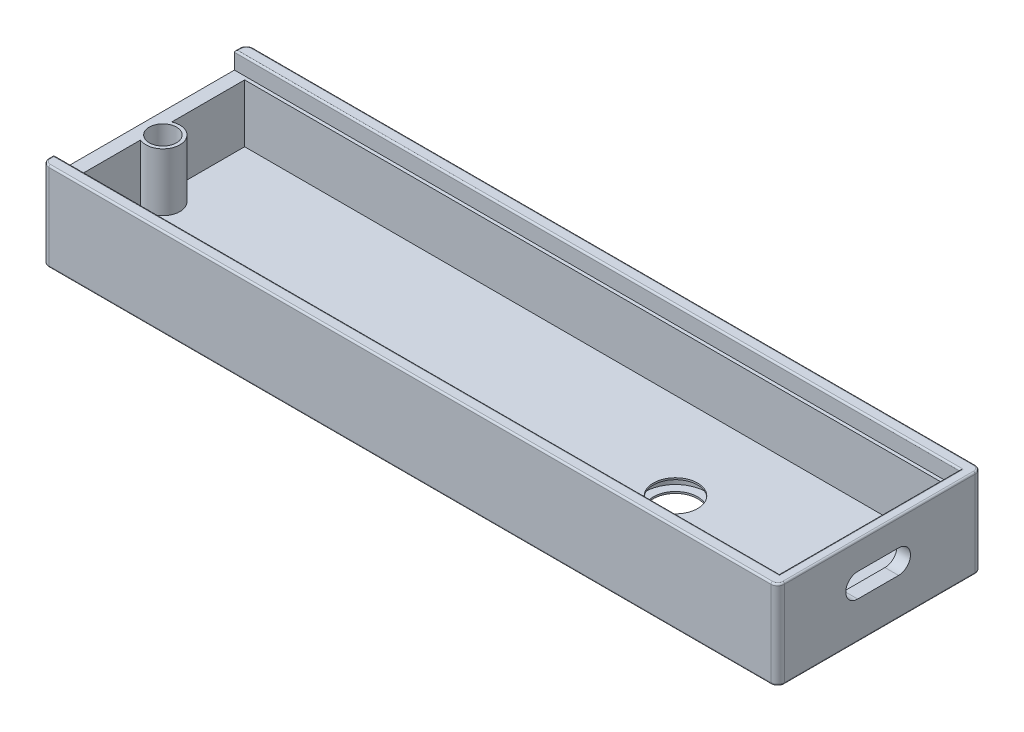
from build123d import *

# Parameters (mm, degrees)
SKETCH1_W                      = 108
SKETCH1_H                      = 30
BOSS_EXTRUDE1_DEPTH            = 13
SKETCH2_W                      = 106.5
SKETCH2_H                      = 26.5
CUT_EXTRUDE1_DEPTH             = 2.5
SKETCH3_W                      = 104
SKETCH3_H                      = 25.5
CUT_EXTRUDE2_DEPTH             = 11
FILLET1_R                      = 0.25
FILLET2_R                      = 1
SKETCH4_R                      = 2.5
BOSS_EXTRUDE2_DEPTH            = 8.5
F_2_2_2_2_DIAMETER_HOLE1_D     = 2.2
F_2_2_2_2_DIAMETER_HOLE1_DEPTH = 7
F_2_2_2_2_DIAMETER_HOLE1_TIP   = 0.660946681
THREAD1_PITCH                  = 0.4
CUT_EXTRUDE3_REACH             = 114.841
SKETCH11_W                     = 26.5
SKETCH11_H                     = 1.125
CUT_EXTRUDE4_DEPTH             = 1
SKETCH13_R                     = 3.25
CUT_EXTRUDE5_DEPTH             = 113.627705322
SKETCH17_R                     = 4.5
CUT_EXTRUDE6_DEPTH             = 0.75
SKETCH18_R                     = 2
CUT_EXTRUDE7_DEPTH             = 4


with BuildPart() as part:
    # Sketch1 → Boss-Extrude1 (new body)
    with BuildSketch(Plane(origin=(0, 0, 0), x_dir=(1, 0, 0), z_dir=(0, 1, 0))):
        with Locations((54, -15)):
            Rectangle(SKETCH1_W, SKETCH1_H)
    extrude(amount=-BOSS_EXTRUDE1_DEPTH)

    # Sketch2 → Cut-Extrude1 (cut)
    with BuildSketch(Plane(origin=(0, 0, 0), x_dir=(1, 0, 0), z_dir=(0, 1, 0))):
        with Locations((53.25, -15)):
            Rectangle(SKETCH2_W, SKETCH2_H)
    extrude(amount=-CUT_EXTRUDE1_DEPTH, mode=Mode.SUBTRACT)

    # Sketch3 → Cut-Extrude2 (cut)
    with BuildSketch(Plane(origin=(0, 0, 0), x_dir=(1, 0, 0), z_dir=(0, 1, 0))):
        with Locations((54, -15)):
            Rectangle(SKETCH3_W, SKETCH3_H)
    extrude(amount=-CUT_EXTRUDE2_DEPTH, mode=Mode.SUBTRACT)

    # Fillet1
    fillet1_edges = [part.edges().sort_by_distance(p)[0] for p in [
        (108, -13, 15),
        (0, 0, 29.125),
        (54, -13, 0),
        (53.25, 0, 28.25),
        (106.5, 0, 15),
        (53.25, 0, 1.75),
        (0, -13, 15),
        (54, 0, 0),
        (108, 0, 15),
        (54, 0, 30),
        (0, 0, 0.875),
        (54, -13, 30),
    ]]
    fillet(fillet1_edges, radius=FILLET1_R)

    # Fillet2
    # the kernel refuses this fillet: 1 mm, written as the material it takes off along each edge
    with BuildSketch(Plane(origin=(1, -13, 1), x_dir=(-1, 0, 0), z_dir=(0, 0, 1))) as fillet2_piece_1:
        with BuildLine():
            CenterArc((0.75, -0.25), 0.25, 0, 90)
            Line((1, -0.25), (1, 0))
            Line((1, 0), (0.75, 0))
        make_face()
    revolve(axis=Axis((1, -13, 1), (0, -1, 0)), revolution_arc=90, mode=Mode.SUBTRACT)
    with BuildSketch(Plane(origin=(107, -13, 1), x_dir=(0, 0, -1), z_dir=(-1, 0, 0))) as fillet2_piece_2:
        with BuildLine():
            CenterArc((0.75, -0.25), 0.25, 0, 90)
            Line((1, -0.25), (1, 0))
            Line((1, 0), (0.75, 0))
        make_face()
    revolve(axis=Axis((107, -13, 1), (0, -1, 0)), revolution_arc=90, mode=Mode.SUBTRACT)
    with BuildSketch(Plane(origin=(1, -13, 29), x_dir=(0, 0, 1), z_dir=(1, 0, 0))) as fillet2_piece_3:
        with BuildLine():
            CenterArc((0.75, -0.25), 0.25, 0, 90)
            Line((1, -0.25), (1, 0))
            Line((1, 0), (0.75, 0))
        make_face()
    revolve(axis=Axis((1, -13, 29), (0, -1, 0)), revolution_arc=90, mode=Mode.SUBTRACT)
    with BuildSketch(Plane(origin=(107, -13, 29), x_dir=(1, 0, 0), z_dir=(0, 0, -1))) as fillet2_piece_4:
        with BuildLine():
            CenterArc((0.75, -0.25), 0.25, 0, 90)
            Line((1, -0.25), (1, 0))
            Line((1, 0), (0.75, 0))
        make_face()
    revolve(axis=Axis((107, -13, 29), (0, -1, 0)), revolution_arc=90, mode=Mode.SUBTRACT)
    with BuildSketch(Plane(origin=(1, 0, 29), x_dir=(-1, 0, 0), z_dir=(0, 0, -1))) as fillet2_piece_5:
        with BuildLine():
            CenterArc((0.75, -0.25), 0.25, 0, 90)
            Line((1, -0.25), (1, 0))
            Line((1, 0), (0.75, 0))
        make_face()
    revolve(axis=Axis((1, 0, 29), (0, 1, 0)), revolution_arc=90, mode=Mode.SUBTRACT)
    with BuildSketch(Plane(origin=(107, 0, 29), x_dir=(0, 0, 1), z_dir=(-1, 0, 0))) as fillet2_piece_6:
        with BuildLine():
            CenterArc((0.75, -0.25), 0.25, 0, 90)
            Line((1, -0.25), (1, 0))
            Line((1, 0), (0.75, 0))
        make_face()
    revolve(axis=Axis((107, 0, 29), (0, 1, 0)), revolution_arc=90, mode=Mode.SUBTRACT)
    with BuildSketch(Plane(origin=(107, 0, 1), x_dir=(1, 0, 0), z_dir=(0, 0, 1))) as fillet2_piece_7:
        with BuildLine():
            CenterArc((0.75, -0.25), 0.25, 0, 90)
            Line((1, -0.25), (1, 0))
            Line((1, 0), (0.75, 0))
        make_face()
    revolve(axis=Axis((107, 0, 1), (0, 1, 0)), revolution_arc=90, mode=Mode.SUBTRACT)
    with BuildSketch(Plane(origin=(1, 0, 1), x_dir=(0, 0, -1), z_dir=(1, 0, 0))) as fillet2_piece_8:
        with BuildLine():
            CenterArc((0.75, -0.25), 0.25, 0, 90)
            Line((1, -0.25), (1, 0))
            Line((1, 0), (0.75, 0))
        make_face()
    revolve(axis=Axis((1, 0, 1), (0, 1, 0)), revolution_arc=90, mode=Mode.SUBTRACT)
    with BuildSketch(Plane(origin=(0, 0, 30), x_dir=(0, 0, -1), z_dir=(0, -1, 0)), Plane(origin=(0, 0, 0), x_dir=(1, 0, 0), z_dir=(0, -1, 0))) as fillet2_piece_9:
        with BuildLine():
            CenterArc((FILLET2_R, FILLET2_R), FILLET2_R, 180, 90)
            Line((0, FILLET2_R), (0, 0))
            Line((0, 0), (FILLET2_R, 0))
        make_face()
    extrude(amount=13, mode=Mode.SUBTRACT)
    with BuildSketch(Plane(origin=(108, 0, 30), x_dir=(0, 0, -1), z_dir=(0, -1, 0)), Plane(origin=(108, 0, 0), x_dir=(-1, 0, 0), z_dir=(0, -1, 0))) as fillet2_piece_10:
        with BuildLine():
            CenterArc((FILLET2_R, -FILLET2_R), FILLET2_R, 90, 90)
            Line((0, -FILLET2_R), (0, 0))
            Line((0, 0), (FILLET2_R, 0))
        make_face()
    extrude(amount=13, mode=Mode.SUBTRACT)

    # Sketch4 → Boss-Extrude2 (add)
    with BuildSketch(Plane(origin=(0, -11, 0), x_dir=(1, 0, 0), z_dir=(0, 1, 0))):
        with Locations((3, -15.25)):
            Circle(SKETCH4_R)
    extrude(amount=BOSS_EXTRUDE2_DEPTH)

    # Ø2.2 (2.2) Diameter Hole1
    with Locations(Plane(origin=(3, -2.5, 15.25), x_dir=(0, 0, 1), z_dir=(0, 1, 0))):
        with Locations((0, 0)):
            Hole(F_2_2_2_2_DIAMETER_HOLE1_D / 2, depth=F_2_2_2_2_DIAMETER_HOLE1_DEPTH)
            with Locations((0, 0, -(F_2_2_2_2_DIAMETER_HOLE1_DEPTH + F_2_2_2_2_DIAMETER_HOLE1_TIP / 2))):  # 118° drill point
                Cone(0, F_2_2_2_2_DIAMETER_HOLE1_D / 2, F_2_2_2_2_DIAMETER_HOLE1_TIP, mode=Mode.SUBTRACT)

    # Thread1: the profile of Thread Profile1 profile screwed along a right-hand helix of 10 turns, 6 arcs to a turn; built about Z, then put on its axis
    thread1_z = Axis((0, 0, 0), (0, 0, 1))
    thread1_corners = [(1.0997, 0, -0.000173205), (1.31650635, 0, 0.124999999), (1.31650635, 0, 0.174999999), (1.0997, 0, 0.300173204)]
    with BuildLine(mode=Mode.PRIVATE) as thread1_profile:
        Line(thread1_corners[0], thread1_corners[1])
        Line(thread1_corners[1], thread1_corners[2])
        Line(thread1_corners[2], thread1_corners[3])
        Line(thread1_corners[3], thread1_corners[0])
    thread1_cap = Face(thread1_profile.wire())
    thread1_turn_angles = [0, 30, 60, 90, 120, 150, 180, 210, 240, 270, 300, 330, 360]
    thread1_turn_weights = [1, 0.8660254037844387, 1, 0.8660254037844387, 1, 0.8660254037844387, 1, 0.8660254037844387, 1, 0.8660254037844387, 1, 0.8660254037844387, 1]
    thread1_turn_rails = [Edge.make_bspline([Vector(p[0], p[1], 0).rotate(thread1_z, thread1_turn_angles[k]) / thread1_turn_weights[k] + Vector(0, 0, p[2] + THREAD1_PITCH * thread1_turn_angles[k] / 360) for k in range(13)], [0, 0, 0, 1, 1, 2, 2, 3, 3, 4, 4, 5, 5, 6, 6, 6], 2, thread1_turn_weights) for p in thread1_corners]
    thread1_turn_sides = [Face.make_surface_from_curves(thread1_turn_rails[p[0]], thread1_turn_rails[p[1]]) for p in [(0, 1), (1, 2), (2, 3), (3, 0)]]
    thread1 = Plane(origin=(3, -2.5, 15.25), x_dir=(-1, 0, 0), z_dir=(0, -1, 0)) * Solid(Shell([*[p.moved(Location((0, 0, THREAD1_PITCH * i))) for i in range(10) for p in thread1_turn_sides], thread1_cap, thread1_cap.rotate(thread1_z, 3600).moved(Location((0, 0, THREAD1_PITCH * 3600 / 360)))]))
    add(thread1, mode=Mode.SUBTRACT)

    # Sketch9 → Cut-Extrude3 (cut, up to next)
    with BuildSketch(Plane(origin=(108, 0, 0), x_dir=(0, 0, -1), z_dir=(1, 0, 0)), mode=Mode.PRIVATE) as cut_extrude3_sk1:
        with BuildLine():
            Line((-18.25, -4), (-12.25, -4))
            ThreePointArc((-12.25, -4), (-10.5, -5.75), (-12.25, -7.5))
            Line((-12.25, -7.5), (-18.25, -7.5))
            ThreePointArc((-18.25, -7.5), (-20, -5.75), (-18.25, -4))
        make_face()
    cut_extrude3_tool1 = extrude(cut_extrude3_sk1.sketch, amount=-CUT_EXTRUDE3_REACH, mode=Mode.PRIVATE) & part.part
    add(cut_extrude3_tool1.solids().sort_by_distance((108, -5.75, 15.25))[0], mode=Mode.SUBTRACT)

    # Sketch11 → Cut-Extrude4 (cut)
    with BuildSketch(Plane.ZY.offset(-106.5)):
        with Locations((15, -1.9375)):
            Rectangle(SKETCH11_W, SKETCH11_H)
    extrude(amount=-CUT_EXTRUDE4_DEPTH, mode=Mode.SUBTRACT)

    # Sketch13 → Cut-Extrude5 (cut, through all)
    with BuildSketch(Plane(origin=(0, -11, 0), x_dir=(1, 0, 0), z_dir=(0, 1, 0))):
        with Locations(Location((78, -15, 0), (0, 0, 270))):
            Circle(SKETCH13_R)
    extrude(amount=-CUT_EXTRUDE5_DEPTH, mode=Mode.SUBTRACT)

    # Sketch17 → Cut-Extrude6 (cut, symmetric)
    with BuildSketch(Plane(origin=(0, -12, 0), x_dir=(1, 0, 0), z_dir=(0, 1, 0))):
        with Locations(Location((78, -15, 0), (0, 0, 270))):
            Circle(SKETCH17_R)
    extrude(amount=CUT_EXTRUDE6_DEPTH, both=True, mode=Mode.SUBTRACT)

    # Sketch18 → Cut-Extrude7 (cut)
    with BuildSketch(Plane(origin=(0, -2.5, 0), x_dir=(1, 0, 0), z_dir=(0, 1, 0))):
        with Locations(Location((3, -15.25, 0), (0, 0, 270))):
            Circle(SKETCH18_R)
    extrude(amount=-CUT_EXTRUDE7_DEPTH, mode=Mode.SUBTRACT)


solid = part.part
